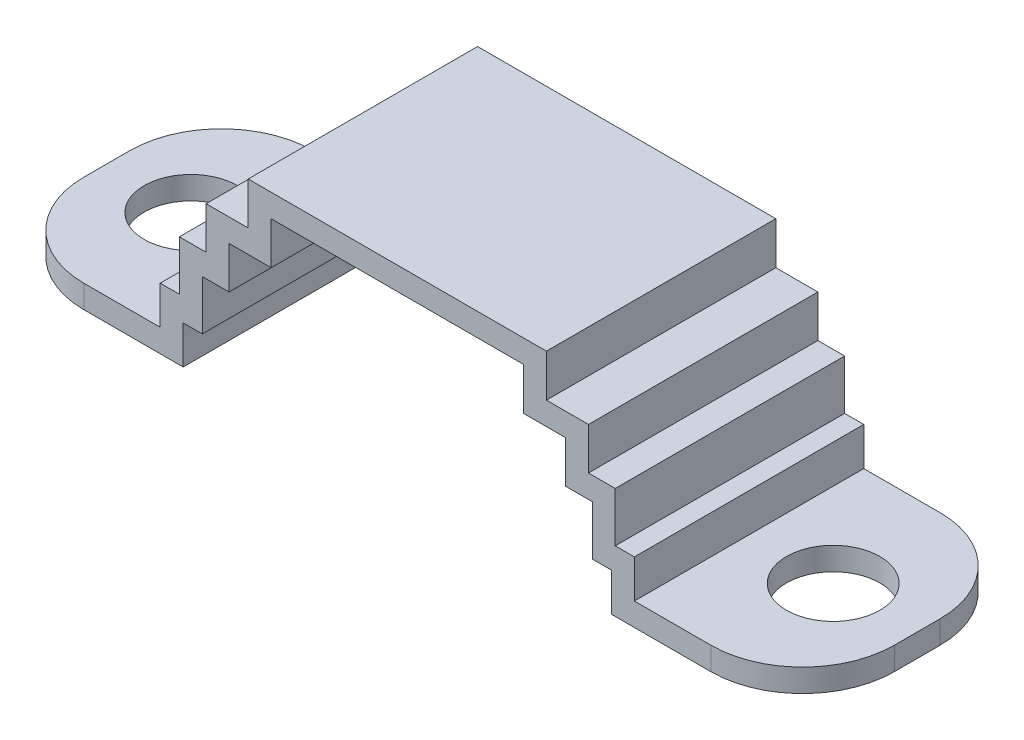
from build123d import *

# Parameters (mm, degrees)
EXTRUDE_THIN1_DEPTH  = 15
SKETCH2_R            = 6.1
CUT_EXTRUDE1_DEPTH   = 60.518925562
FILLET1_R            = 12
FILLET1_OF_MIRROR1_R = 12


with BuildPart() as part:
    # Sketch1 → Extrude-Thin1 (new, symmetric)
    with BuildSketch(Plane.XY):
        Polygon((-53, 4.5), (-28, 4.5), (-28, 9.5), (-25.5, 9.5), (-25.5, 16), (-22, 16), (-22, 21.5), (-16.5, 21.5), (-16.5, 27.05), (0, 27.05), (0, 30.05), (-19.5, 30.05), (-19.5, 24.5), (-25, 24.5), (-25, 19), (-28.5, 19), (-28.5, 12.5), (-31, 12.5), (-31, 7.5), (-53, 7.5), align=None)
    extrude_thin1 = extrude(amount=EXTRUDE_THIN1_DEPTH, both=True)

    # Sketch2 → Cut-Extrude1 (cut, through all)
    with BuildSketch(Plane(origin=(0, 7.5, 0), x_dir=(1, 0, 0), z_dir=(0, 1, 0))):
        with Locations((-42, 0)):
            Circle(SKETCH2_R)
    cut_extrude1 = extrude(amount=-CUT_EXTRUDE1_DEPTH, mode=Mode.SUBTRACT)

    # Fillet1
    fillet1_edges = [part.edges().sort_by_distance(p)[0] for p in [
        (-53, 6, -15),
        (-53, 6, 15),
    ]]
    fillet(fillet1_edges, radius=FILLET1_R)

    # Mirror1: Extrude-Thin1, Cut-Extrude1 across plane
    add(extrude_thin1.mirror(Plane(origin=(0, 30.05, 15), x_dir=(0, 0, 1), z_dir=(1, 0, 0))))
    add(cut_extrude1.mirror(Plane(origin=(0, 30.05, 15), x_dir=(0, 0, 1), z_dir=(1, 0, 0))), mode=Mode.SUBTRACT)

    # Fillet1 of Mirror1
    fillet1_of_mirror1_edges = [part.edges().sort_by_distance(p)[0] for p in [
        (53, 6, -15),
        (53, 6, 15),
    ]]
    fillet(fillet1_of_mirror1_edges, radius=FILLET1_OF_MIRROR1_R)


solid = part.part
